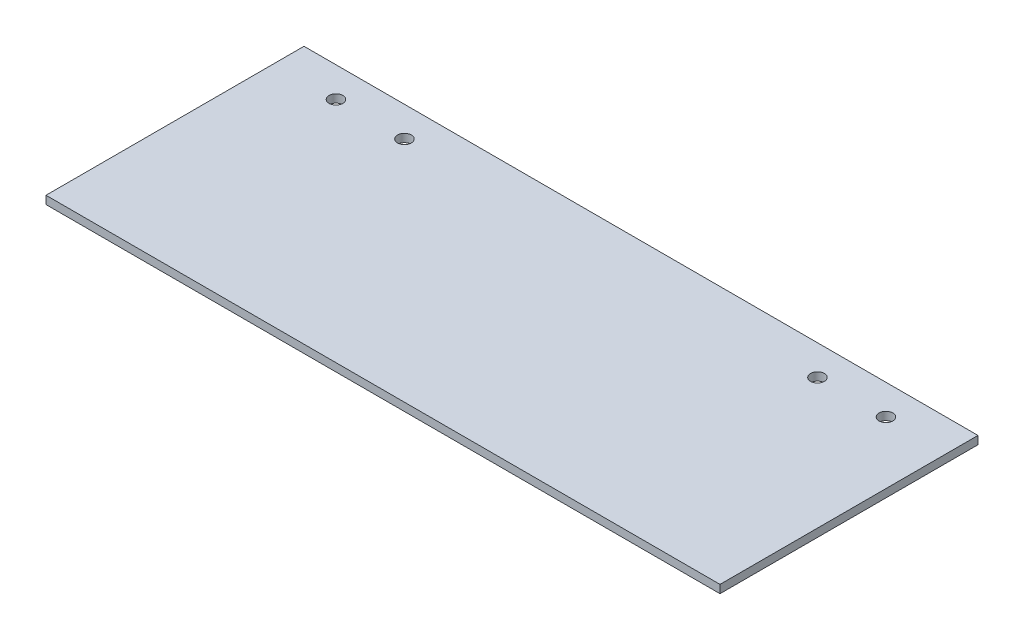
from build123d import *

# Parameters (mm, degrees)
SKETCH1_W           = 250
SKETCH1_H           = 95.7
SKETCH1_R           = 2.564
BOSS_EXTRUDE1_DEPTH = 3


with BuildPart() as part:
    # Sketch1 → Boss-Extrude1 (new body)
    with BuildSketch(Plane(origin=(0, 0, 0), x_dir=(1, 0, 0), z_dir=(0, 1, 0))):
        with Locations((125, 47.85)):
            Rectangle(SKETCH1_W, SKETCH1_H)
        with Locations((23, 84.56)):
            Circle(SKETCH1_R, mode=Mode.SUBTRACT)
        with Locations((48.4, 84.56)):
            Circle(SKETCH1_R, mode=Mode.SUBTRACT)
        with Locations((201.6, 84.56)):
            Circle(SKETCH1_R, mode=Mode.SUBTRACT)
        with Locations((227, 84.56)):
            Circle(SKETCH1_R, mode=Mode.SUBTRACT)
    extrude(amount=BOSS_EXTRUDE1_DEPTH)


solid = part.part
